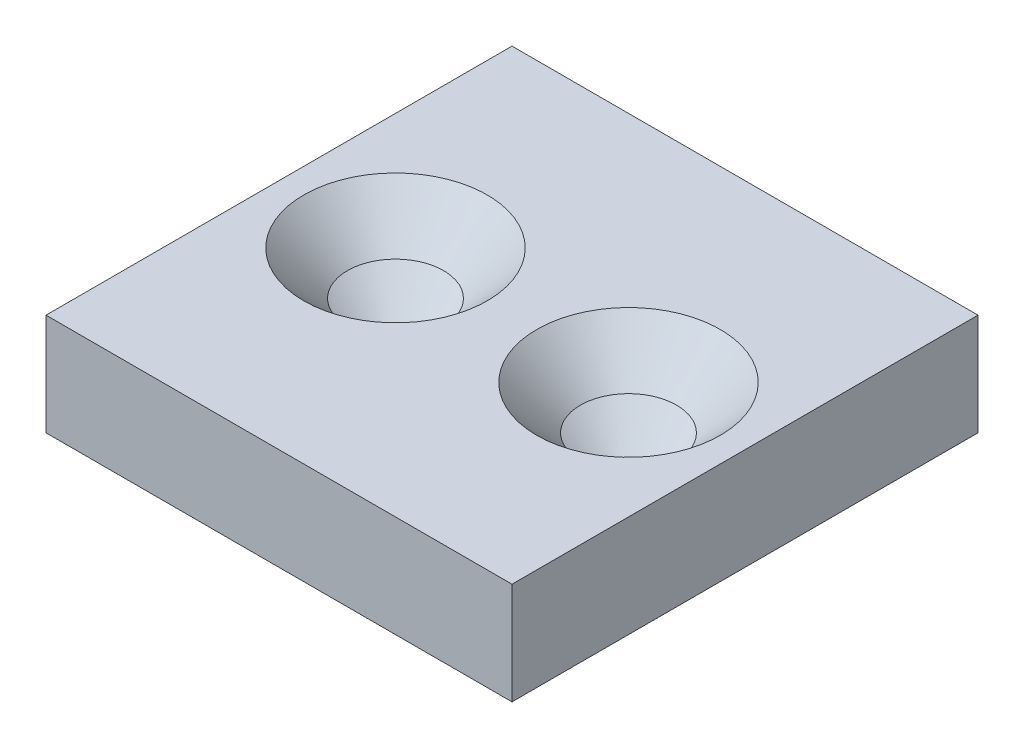
from build123d import *

# Parameters (mm, degrees)
SKETCH1_W           = 32
SKETCH1_H           = 32
BOSS_EXTRUDE1_DEPTH = 7


# Read off the part's stored shape, not the designer's step: AdvancedHole1
with BuildPart() as part:
    # Sketch1 → Boss-Extrude1 (new body)
    with BuildSketch(Plane(origin=(0, 0, 0), x_dir=(1, 0, 0), z_dir=(0, 1, 0))):
        Rectangle(SKETCH1_W, SKETCH1_H)
    extrude(amount=BOSS_EXTRUDE1_DEPTH)

    # AdvancedHole1 outline → AdvancedHole1 (revolve, cut)
    with BuildSketch(Plane(origin=(8, 0, 0), x_dir=(1, 0, 0), z_dir=(0, 0, 1))):
        Polygon((6.3, 4), (3.3, 4), (6.3, 7), (0, 7), (0, 0), (2.3, 0), align=None)
    revolve(axis=Axis((8, 0, 0), (0, 1, 0)), mode=Mode.SUBTRACT)

    # AdvancedHole1 2 outline → AdvancedHole1 2 (revolve, cut)
    with BuildSketch(Plane(origin=(-8, 0, 0), x_dir=(1, 0, 0), z_dir=(0, 0, 1))):
        Polygon((6.3, 4), (3.3, 4), (6.3, 7), (0, 7), (0, 0), (2.3, 0), align=None)
    revolve(axis=Axis((-8, 0, 0), (0, 1, 0)), mode=Mode.SUBTRACT)


solid = part.part
